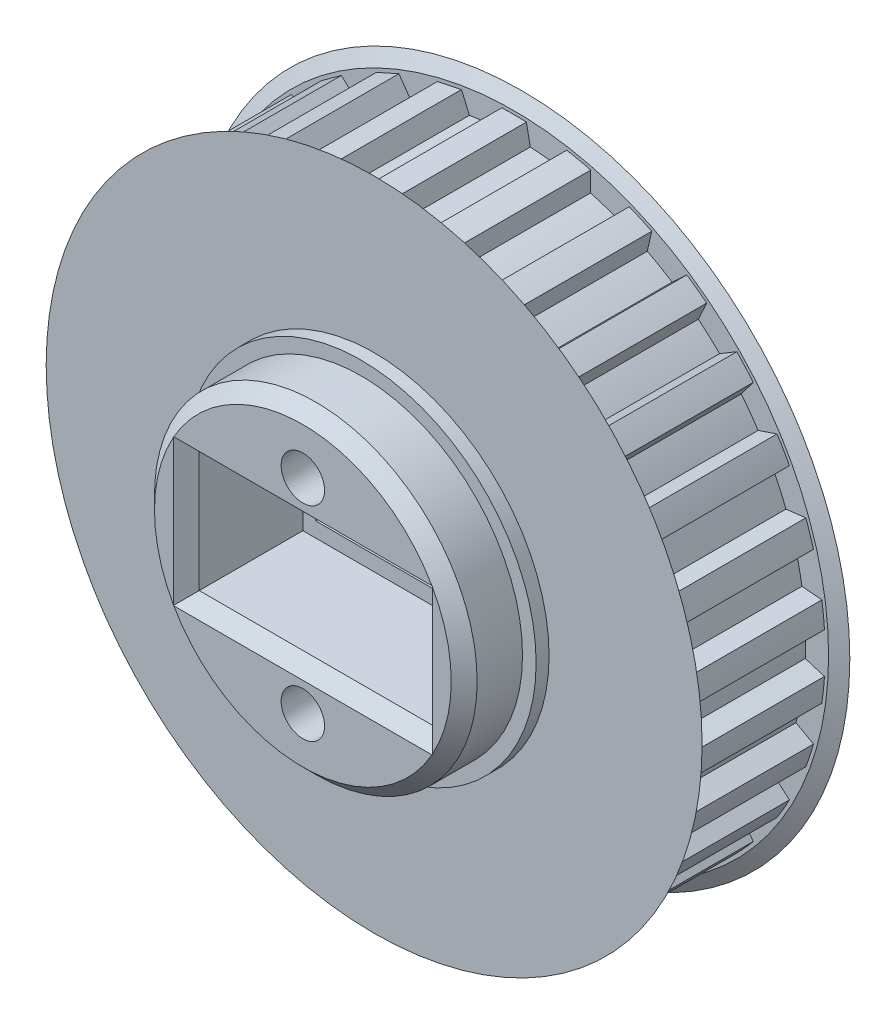
from build123d import *
from build123d.topology import SkipClean

# Parameters (mm, degrees)
CROQUIS1_R                 = 1.5
SALIENTE_EXTRUIR1_DEPTH    = 10.2
CROQUIS2_R                 = 26
CROQUIS2_R_2               = 1.5
SALIENTE_EXTRUIR2_DEPTH    = 0.6
SALIENTE_EXTRUIR4_START    = 4.25
CROQUIS4_R                 = 12.45
CROQUIS4_R_2               = 1.5
SALIENTE_EXTRUIR4_DEPTH    = 4.25
SALIENTE_EXTRUIR6_START    = 0.6
CROQUIS6_R                 = 26
CROQUIS6_R_2               = 1.5
SALIENTE_EXTRUIR6_DEPTH    = 0.6
SALIENTE_EXTRUIR5_START    = 1.6
CROQUIS5_R                 = 13.5
CROQUIS5_R_2               = 1.5
SALIENTE_EXTRUIR5_DEPTH    = 1.6
CHAFL_N2_SIZE              = 1.732050808
CHAFL_N2_SIZE_2            = 1
CROQUIS3_R                 = 12.45
CROQUIS3_R_2               = 1.5
SALIENTE_EXTRUIR7_DEPTH    = 5.5
CHAFL_N4_SIZE              = 1
CROQUIS7_R                 = 13.5
CROQUIS7_R_2               = 1.5
SALIENTE_EXTRUIR8_DEPTH    = 1
CORTAR_EXTRUIR1_DEPTH      = 40.326793492
CORTAR_EXTRUIR1_DEPTH_BACK = 40.326793492
CROQUIS8_R                 = 1.675
CROQUIS8_W                 = 16
CROQUIS8_H                 = 7
CROQUIS10_W                = 18
CROQUIS10_H                = 9.3
CORTAR_EXTRUIR3_DEPTH      = 9
CHAFL_N5_SIZE              = 1
SKETCH1_R                  = 12.45
SKETCH1_R_2                = 1.675
BOSS_EXTRUDE1_DEPTH        = 5
SKETCH2_R                  = 1.45
CUT_EXTRUDE1_DEPTH         = 5
SKETCH4_W                  = 8
SKETCH4_H                  = 7
CUT_EXTRUDE2_DEPTH         = 21
CHAMFER3_SIZE              = 1
CHAMFER2_SIZE              = 0.75


# Some blends are built 0.0001 mm under size
with BuildPart() as part:
    # Croquis1 → Saliente-Extruir1 (new body)
    with BuildSketch(Plane.XY):
        with BuildLine():
            Line((-0.95, 23.981190546), (-1.25, 22.465250945))
            ThreePointArc((-1.25, 22.465250945), (-2.351890424, 22.376742646), (-3.448103808, 22.234220925))
            Line((-3.448103808, 22.234220925), (-4.056729654, 23.654660102))
            Line((-4.056729654, 23.654660102), (-5.915210095, 23.259627889))
            Line((-5.915210095, 23.259627889), (-5.893472809, 21.714441698))
            ThreePointArc((-5.893472809, 21.714441698), (-6.952882373, 21.398771617), (-7.995508933, 21.031448759))
            Line((-7.995508933, 21.031448759), (-8.886160755, 22.294307503))
            Line((-8.886160755, 22.294307503), (-10.621897124, 21.521507881))
            Line((-10.621897124, 21.521507881), (-10.279372577, 20.014607151))
            ThreePointArc((-10.279372577, 20.014607151), (-11.25, 19.485571585), (-12.193471951, 18.909501362))
            Line((-12.193471951, 18.909501362), (-13.327223991, 19.959586687))
            Line((-13.327223991, 19.959586687), (-14.86435628, 18.842794707))
            Line((-14.86435628, 18.842794707), (-14.216014437, 17.440038232))
            ThreePointArc((-14.216014437, 17.440038232), (-15.055438643, 16.720758573), (-15.858521735, 15.961118018))
            Line((-15.858521735, 15.961118018), (-17.185823587, 16.752536155))
            Line((-17.185823587, 16.752536155), (-18.457171739, 15.340560987))
            Line((-18.457171739, 15.340560987), (-17.53134825, 14.103255955))
            ThreePointArc((-17.53134825, 14.103255955), (-18.202882373, 13.225168177), (-18.83047802, 12.315157227))
            Line((-18.83047802, 12.315157227), (-20.293320226, 12.813319407))
            ThreePointArc((-20.293320226, 12.813319407), (-20.784609691, 12), (-21.243320226, 11.167871139))
            Line((-21.243320226, 11.167871139), (-20.08047802, 10.150093718))
            ThreePointArc((-20.08047802, 10.150093718), (-20.554772797, 9.151574469), (-20.979452058, 8.13096497))
            Line((-20.979452058, 8.13096497), (-22.513901393, 8.314099115))
            ThreePointArc((-22.513901393, 8.314099115), (-22.825356391, 7.416407865), (-23.101033682, 6.507091734))
            Line((-23.101033682, 6.507091734), (-21.751994544, 5.753323679))
            ThreePointArc((-21.751994544, 5.753323679), (-22.008321017, 4.678013043), (-22.21152337, 3.591410527))
            Line((-22.21152337, 3.591410527), (-23.750517035, 3.451512796))
            ThreePointArc((-23.750517035, 3.451512796), (-23.868525489, 2.508683118), (-23.949121115, 1.561921194))
            Line((-23.949121115, 1.561921194), (-22.472844528, 1.105105789))
            ThreePointArc((-22.472844528, 1.105105789), (-22.5, 0), (-22.472844528, -1.105105789))
            Line((-22.472844528, -1.105105789), (-23.949121115, -1.561921194))
            ThreePointArc((-23.949121115, -1.561921194), (-23.868525489, -2.508683118), (-23.750517035, -3.451512796))
            Line((-23.750517035, -3.451512796), (-22.21152337, -3.591410527))
            ThreePointArc((-22.21152337, -3.591410527), (-22.008321017, -4.678013043), (-21.751994544, -5.753323679))
            Line((-21.751994544, -5.753323679), (-23.101033682, -6.507091734))
            ThreePointArc((-23.101033682, -6.507091734), (-22.825356391, -7.416407865), (-22.513901393, -8.314099115))
            Line((-22.513901393, -8.314099115), (-20.979452058, -8.13096497))
            ThreePointArc((-20.979452058, -8.13096497), (-20.554772797, -9.151574469), (-20.08047802, -10.150093718))
            Line((-20.08047802, -10.150093718), (-21.243320226, -11.167871139))
            ThreePointArc((-21.243320226, -11.167871139), (-20.784609691, -12), (-20.293320226, -12.813319407))
            Line((-20.293320226, -12.813319407), (-18.83047802, -12.315157227))
            ThreePointArc((-18.83047802, -12.315157227), (-18.202882373, -13.225168177), (-17.53134825, -14.103255955))
            Line((-17.53134825, -14.103255955), (-18.457171739, -15.340560987))
            ThreePointArc((-18.457171739, -15.340560987), (-17.835475811, -16.059134553), (-17.185823587, -16.752536155))
            Line((-17.185823587, -16.752536155), (-15.858521735, -15.961118018))
            ThreePointArc((-15.858521735, -15.961118018), (-15.055438643, -16.720758573), (-14.216014437, -17.440038232))
            Line((-14.216014437, -17.440038232), (-14.86435628, -18.842794707))
            ThreePointArc((-14.86435628, -18.842794707), (-14.106846055, -19.416407865), (-13.327223991, -19.959586687))
            Line((-13.327223991, -19.959586687), (-12.193471951, -18.909501362))
            ThreePointArc((-12.193471951, -18.909501362), (-11.25, -19.485571585), (-10.279372577, -20.014607151))
            Line((-10.279372577, -20.014607151), (-10.621897124, -21.521507881))
            ThreePointArc((-10.621897124, -21.521507881), (-9.761679434, -21.925090983), (-8.886160755, -22.294307503))
            Line((-8.886160755, -22.294307503), (-7.995508933, -21.031448759))
            ThreePointArc((-7.995508933, -21.031448759), (-6.952882373, -21.398771617), (-5.893472809, -21.714441698))
            Line((-5.893472809, -21.714441698), (-5.915210095, -23.259627889))
            ThreePointArc((-5.915210095, -23.259627889), (-4.98988058, -23.475542418), (-4.056729654, -23.654660102))
            Line((-4.056729654, -23.654660102), (-3.448103808, -22.234220925))
            ThreePointArc((-3.448103808, -22.234220925), (-2.351890424, -22.376742646), (-1.25, -22.465250945))
            Line((-1.25, -22.465250945), (-0.95, -23.981190546))
            ThreePointArc((-0.95, -23.981190546), (0, -24), (0.95, -23.981190546))
            Line((0.95, -23.981190546), (1.25, -22.465250945))
            ThreePointArc((1.25, -22.465250945), (2.351890424, -22.376742646), (3.448103808, -22.234220925))
            Line((3.448103808, -22.234220925), (4.056729654, -23.654660102))
            ThreePointArc((4.056729654, -23.654660102), (4.98988058, -23.475542418), (5.915210095, -23.259627889))
            Line((5.915210095, -23.259627889), (5.893472809, -21.714441698))
            ThreePointArc((5.893472809, -21.714441698), (6.952882373, -21.398771617), (7.995508933, -21.031448759))
            Line((7.995508933, -21.031448759), (8.886160755, -22.294307503))
            ThreePointArc((8.886160755, -22.294307503), (9.761679434, -21.925090983), (10.621897124, -21.521507881))
            Line((10.621897124, -21.521507881), (10.279372577, -20.014607151))
            ThreePointArc((10.279372577, -20.014607151), (11.25, -19.485571585), (12.193471951, -18.909501362))
            Line((12.193471951, -18.909501362), (13.327223991, -19.959586687))
            ThreePointArc((13.327223991, -19.959586687), (14.106846055, -19.416407865), (14.86435628, -18.842794707))
            Line((14.86435628, -18.842794707), (14.216014437, -17.440038232))
            ThreePointArc((14.216014437, -17.440038232), (15.055438643, -16.720758573), (15.858521735, -15.961118018))
            Line((15.858521735, -15.961118018), (17.185823587, -16.752536155))
            ThreePointArc((17.185823587, -16.752536155), (17.835475811, -16.059134553), (18.457171739, -15.340560987))
            Line((18.457171739, -15.340560987), (17.53134825, -14.103255955))
            ThreePointArc((17.53134825, -14.103255955), (18.202882373, -13.225168177), (18.83047802, -12.315157227))
            Line((18.83047802, -12.315157227), (20.293320226, -12.813319407))
            ThreePointArc((20.293320226, -12.813319407), (20.784609691, -12), (21.243320226, -11.167871139))
            Line((21.243320226, -11.167871139), (20.08047802, -10.150093718))
            ThreePointArc((20.08047802, -10.150093718), (20.554772797, -9.151574469), (20.979452058, -8.13096497))
            Line((20.979452058, -8.13096497), (22.513901393, -8.314099115))
            ThreePointArc((22.513901393, -8.314099115), (22.825356391, -7.416407865), (23.101033682, -6.507091734))
            Line((23.101033682, -6.507091734), (21.751994544, -5.753323679))
            ThreePointArc((21.751994544, -5.753323679), (22.008321017, -4.678013043), (22.21152337, -3.591410527))
            Line((22.21152337, -3.591410527), (23.750517035, -3.451512796))
            ThreePointArc((23.750517035, -3.451512796), (23.868525489, -2.508683118), (23.949121115, -1.561921194))
            Line((23.949121115, -1.561921194), (22.472844528, -1.105105789))
            ThreePointArc((22.472844528, -1.105105789), (22.5, 0), (22.472844528, 1.105105789))
            Line((22.472844528, 1.105105789), (23.949121115, 1.561921194))
            ThreePointArc((23.949121115, 1.561921194), (23.868525489, 2.508683118), (23.750517035, 3.451512796))
            Line((23.750517035, 3.451512796), (22.21152337, 3.591410527))
            ThreePointArc((22.21152337, 3.591410527), (22.008321017, 4.678013043), (21.751994544, 5.753323679))
            Line((21.751994544, 5.753323679), (23.101033682, 6.507091734))
            ThreePointArc((23.101033682, 6.507091734), (22.825356391, 7.416407865), (22.513901393, 8.314099115))
            Line((22.513901393, 8.314099115), (20.979452058, 8.13096497))
            ThreePointArc((20.979452058, 8.13096497), (20.554772797, 9.151574469), (20.08047802, 10.150093718))
            Line((20.08047802, 10.150093718), (21.243320226, 11.167871139))
            ThreePointArc((21.243320226, 11.167871139), (20.784609691, 12), (20.293320226, 12.813319407))
            Line((20.293320226, 12.813319407), (18.83047802, 12.315157227))
            ThreePointArc((18.83047802, 12.315157227), (18.202882373, 13.225168177), (17.53134825, 14.103255955))
            Line((17.53134825, 14.103255955), (18.457171739, 15.340560987))
            ThreePointArc((18.457171739, 15.340560987), (17.835475811, 16.059134553), (17.185823587, 16.752536155))
            Line((17.185823587, 16.752536155), (15.858521735, 15.961118018))
            ThreePointArc((15.858521735, 15.961118018), (15.055438643, 16.720758573), (14.216014437, 17.440038232))
            Line((14.216014437, 17.440038232), (14.86435628, 18.842794707))
            ThreePointArc((14.86435628, 18.842794707), (14.106846055, 19.416407865), (13.327223991, 19.959586687))
            Line((13.327223991, 19.959586687), (12.193471951, 18.909501362))
            ThreePointArc((12.193471951, 18.909501362), (11.25, 19.485571585), (10.279372577, 20.014607151))
            Line((10.279372577, 20.014607151), (10.621897124, 21.521507881))
            ThreePointArc((10.621897124, 21.521507881), (9.761679434, 21.925090983), (8.886160755, 22.294307503))
            Line((8.886160755, 22.294307503), (7.995508933, 21.031448759))
            ThreePointArc((7.995508933, 21.031448759), (6.952882373, 21.398771617), (5.893472809, 21.714441698))
            Line((5.893472809, 21.714441698), (5.915210095, 23.259627889))
            ThreePointArc((5.915210095, 23.259627889), (4.98988058, 23.475542418), (4.056729654, 23.654660102))
            Line((4.056729654, 23.654660102), (3.448103808, 22.234220925))
            ThreePointArc((3.448103808, 22.234220925), (2.351890424, 22.376742646), (1.25, 22.465250945))
            Line((1.25, 22.465250945), (0.95, 23.981190546))
            ThreePointArc((0.95, 23.981190546), (0, 24), (-0.95, 23.981190546))
        make_face()
        Circle(CROQUIS1_R, mode=Mode.SUBTRACT)
    extrude(amount=SALIENTE_EXTRUIR1_DEPTH)

    # Croquis2 → Saliente-Extruir2 (add)
    with BuildSketch(Plane.XY.offset(10.2)):
        Circle(CROQUIS2_R)
        Circle(CROQUIS2_R_2, mode=Mode.SUBTRACT)
    extrude(amount=SALIENTE_EXTRUIR2_DEPTH)

    # Croquis4 → Saliente-Extruir4 (add)
    with BuildSketch(Plane(origin=(0, 0, 0), x_dir=(-1, 0, 0), z_dir=(0, 0, -1)).offset(SALIENTE_EXTRUIR4_START)):
        with Locations(Location((0, 0, 0), (0, 0, 180))):
            Circle(CROQUIS4_R)
        Circle(CROQUIS4_R_2, mode=Mode.SUBTRACT)
    extrude(amount=-SALIENTE_EXTRUIR4_DEPTH)

    # Croquis6 → Saliente-Extruir6 (add)
    with SkipClean():  # the faces are left unmerged after this step: merging them gives an invalid solid
        with BuildSketch(Plane(origin=(0, 0, 0), x_dir=(-1, 0, 0), z_dir=(0, 0, -1)).offset(SALIENTE_EXTRUIR6_START)):
            with Locations(Location((0, 0, 0), (0, 0, 180))):
                Circle(CROQUIS6_R)
            Circle(CROQUIS6_R_2, mode=Mode.SUBTRACT)
        extrude(amount=-SALIENTE_EXTRUIR6_DEPTH)

    # Croquis5 → Saliente-Extruir5 (add)
    with SkipClean():  # the faces are left unmerged after this step: merging them gives an invalid solid
        with BuildSketch(Plane(origin=(0, 0, -0.6), x_dir=(-1, 0, 0), z_dir=(0, 0, -1)).offset(SALIENTE_EXTRUIR5_START)):
            Circle(CROQUIS5_R)
            Circle(CROQUIS5_R_2, mode=Mode.SUBTRACT)
        extrude(amount=-SALIENTE_EXTRUIR5_DEPTH)

    # Chaflán2
    # the kernel refuses this chamfer: 1.732050808, 1 mm, written as the material it takes off along each edge
    with BuildSketch(Plane(origin=(0, 0, 0), x_dir=(1, 0, 0), z_dir=(0, 1, 0))) as chafl_n2_piece_1:
        Polygon((26 - CHAFL_N2_SIZE, 0), (26, CHAFL_N2_SIZE_2), (26, 0), align=None)
    revolve(axis=Axis((0, 0, 0), (0, 0, -1)), mode=Mode.SUBTRACT)
    with BuildSketch(Plane(origin=(0, 0, 10.2), x_dir=(1, 0, 0), z_dir=(0, -1, 0))) as chafl_n2_piece_2:
        Polygon((26 - CHAFL_N2_SIZE, 0), (26, CHAFL_N2_SIZE_2), (26, 0), align=None)
    revolve(axis=Axis((0, 0, 10.2), (0, 0, 1)), mode=Mode.SUBTRACT)

    # Croquis3 → Saliente-Extruir7 (add)
    with BuildSketch(Plane.XY.offset(10.8)):
        with Locations(Location((0, 0, 0), (0, 0, 180))):
            Circle(CROQUIS3_R)
        with Locations(Location((0, 0, 0), (0, 0, 180))):
            Circle(CROQUIS3_R_2, mode=Mode.SUBTRACT)
    extrude(amount=SALIENTE_EXTRUIR7_DEPTH)

    # Chaflán4
    chafl_n4_edges = [part.edges().sort_by_distance(p)[0] for p in [
        (12.45, 0, 16.3),
    ]]
    chamfer(chafl_n4_edges, length=CHAFL_N4_SIZE)

    # Croquis7 → Saliente-Extruir8 (add)
    with BuildSketch(Plane.XY.offset(10.8)):
        with Locations(Location((0, 0, 0), (0, 0, 180))):
            Circle(CROQUIS7_R)
        with Locations(Location((0, 0, 0), (0, 0, 180))):
            Circle(CROQUIS7_R_2, mode=Mode.SUBTRACT)
    extrude(amount=SALIENTE_EXTRUIR8_DEPTH)

    # Croquis8 → Cortar-Extruir1 (cut, two sides: drawn at the far end of the back side and taken through both)
    with BuildSketch(Plane.XY.offset(-CORTAR_EXTRUIR1_DEPTH_BACK)):
        with Locations((0, 7.875631857)):
            Circle(CROQUIS8_R)
        with Locations((0, -7.875631857)):
            Circle(CROQUIS8_R)
        Rectangle(CROQUIS8_W, CROQUIS8_H)
    extrude(amount=CORTAR_EXTRUIR1_DEPTH + CORTAR_EXTRUIR1_DEPTH_BACK, mode=Mode.SUBTRACT)

    # Croquis10 → Cortar-Extruir3 (cut)
    with BuildSketch(Plane.XY.offset(16.3)):
        Rectangle(CROQUIS10_W, CROQUIS10_H)
    extrude(amount=-CORTAR_EXTRUIR3_DEPTH, mode=Mode.SUBTRACT)

    # Chaflán5
    # the kernel refuses this chamfer: 1 mm, written as the material it takes off along each edge
    with BuildSketch(Plane(origin=(8, 3.5, -4.25), x_dir=(0.9996219169112968, 0, -0.02749587661058651), z_dir=(0, -1, 0)), Plane(origin=(-8, -3.5, -4.25), x_dir=(-0.9996219169112968, 0, -0.02749587661058651), z_dir=(0, 1, 0))) as chafl_n5_piece_1:
        Polygon((CHAFL_N5_SIZE * 0.999621916911, CHAFL_N5_SIZE * 0.0274958766106), (-CHAFL_N5_SIZE * 0.0274958766106, CHAFL_N5_SIZE * 0.999621916911), (0, 0), align=None)
    extrude(amount=7, mode=Mode.SUBTRACT)
    with BuildSketch(Plane(origin=(8, -3.5, -4.25), x_dir=(0, -0.9996219169112968, -0.027495876610586497), z_dir=(-1, 0, 0)), Plane(origin=(-8, 3.5, -4.25), x_dir=(0, 0.9996219169112968, -0.027495876610586487), z_dir=(1, 0, 0))) as chafl_n5_piece_2:
        Polygon((CHAFL_N5_SIZE * 0.999621916911, CHAFL_N5_SIZE * 0.0274958766106), (-CHAFL_N5_SIZE * 0.0274958766106, CHAFL_N5_SIZE * 0.999621916911), (0, 0), align=None)
    extrude(amount=16, mode=Mode.SUBTRACT)
    with BuildSketch(Plane(origin=(-9, 4.65, 16.3), x_dir=(-0.9996219169112968, 0, 0.027495876610585647), z_dir=(0, -1, 0)), Plane(origin=(9, -4.65, 16.3), x_dir=(0.9996219169112968, 0, 0.027495876610585647), z_dir=(0, 1, 0))) as chafl_n5_piece_3:
        Polygon((CHAFL_N5_SIZE * 0.999621916911, CHAFL_N5_SIZE * 0.0274958766106), (-CHAFL_N5_SIZE * 0.0274958766106, CHAFL_N5_SIZE * 0.999621916911), (0, 0), align=None)
    extrude(amount=9.3, mode=Mode.SUBTRACT)
    with BuildSketch(Plane(origin=(-9, -4.65, 16.3), x_dir=(0, -0.9996219169112968, 0.027495876610585623), z_dir=(1, 0, 0)), Plane(origin=(9, 4.65, 16.3), x_dir=(0, 0.9996219169112968, 0.027495876610585623), z_dir=(-1, 0, 0))) as chafl_n5_piece_4:
        Polygon((CHAFL_N5_SIZE * 0.999621916911, CHAFL_N5_SIZE * 0.0274958766106), (-CHAFL_N5_SIZE * 0.0274958766106, CHAFL_N5_SIZE * 0.999621916911), (0, 0), align=None)
    extrude(amount=18, mode=Mode.SUBTRACT)
    with BuildSketch(Plane(origin=(-8, 3.5, -4.25), x_dir=(0, 0.9996219169112968, -0.027495876610586487), z_dir=(1, 0, 0))) as chafl_n5_piece_5a_section:
        Polygon((CHAFL_N5_SIZE * 0.999621916911, CHAFL_N5_SIZE * 0.0274958766106), (-CHAFL_N5_SIZE * 0.0274958766106, CHAFL_N5_SIZE * 0.999621916911), (0, 0), align=None)
    chafl_n5_piece_5a = extrude(amount=18.571682988, mode=Mode.PRIVATE)
    chafl_n5_piece_5a = split(chafl_n5_piece_5a, bisect_by=Plane(origin=(8, 3.829793627, -3.920206373), z_dir=(1, 0, 0)), keep=Keep.TOP, mode=Mode.PRIVATE)
    with BuildSketch(Plane(origin=(8, 6.071682988, -4.25), x_dir=(0.9996219169112968, 0, -0.02749587661058651), z_dir=(0, -1, 0))) as chafl_n5_piece_5b_section:
        Polygon((CHAFL_N5_SIZE * 0.999621916911, CHAFL_N5_SIZE * 0.0274958766106), (-CHAFL_N5_SIZE * 0.0274958766106, CHAFL_N5_SIZE * 0.999621916911), (0, 0), align=None)
    chafl_n5_piece_5b = extrude(amount=9.571682988, mode=Mode.PRIVATE)
    chafl_n5_piece_5b = split(chafl_n5_piece_5b, bisect_by=Plane(origin=(8.329793627, 3.5, -3.920206373), z_dir=(0, 1, 0)), keep=Keep.TOP, mode=Mode.PRIVATE)
    chafl_n5_piece_5 = chafl_n5_piece_5a & chafl_n5_piece_5b
    add(chafl_n5_piece_5, mode=Mode.SUBTRACT)
    with BuildSketch(Plane(origin=(8, 3.5, -4.25), x_dir=(0.9996219169112968, 0, -0.02749587661058651), z_dir=(0, -1, 0))) as chafl_n5_piece_6a_section:
        Polygon((CHAFL_N5_SIZE * 0.999621916911, CHAFL_N5_SIZE * 0.0274958766106), (-CHAFL_N5_SIZE * 0.0274958766106, CHAFL_N5_SIZE * 0.999621916911), (0, 0), align=None)
    chafl_n5_piece_6a = extrude(amount=9.571682988, mode=Mode.PRIVATE)
    chafl_n5_piece_6a = split(chafl_n5_piece_6a, bisect_by=Plane(origin=(8.329793627, -3.5, -3.920206373), z_dir=(0, -1, 0)), keep=Keep.TOP, mode=Mode.PRIVATE)
    with BuildSketch(Plane(origin=(10.571682988, -3.5, -4.25), x_dir=(0, -0.9996219169112968, -0.027495876610586497), z_dir=(-1, 0, 0))) as chafl_n5_piece_6b_section:
        Polygon((CHAFL_N5_SIZE * 0.999621916911, CHAFL_N5_SIZE * 0.0274958766106), (-CHAFL_N5_SIZE * 0.0274958766106, CHAFL_N5_SIZE * 0.999621916911), (0, 0), align=None)
    chafl_n5_piece_6b = extrude(amount=18.571682988, mode=Mode.PRIVATE)
    chafl_n5_piece_6b = split(chafl_n5_piece_6b, bisect_by=Plane(origin=(8, -3.829793627, -3.920206373), z_dir=(1, 0, 0)), keep=Keep.TOP, mode=Mode.PRIVATE)
    chafl_n5_piece_6 = chafl_n5_piece_6a & chafl_n5_piece_6b
    add(chafl_n5_piece_6, mode=Mode.SUBTRACT)
    with BuildSketch(Plane(origin=(8, -3.5, -4.25), x_dir=(0, -0.9996219169112968, -0.027495876610586497), z_dir=(-1, 0, 0))) as chafl_n5_piece_7a_section:
        Polygon((CHAFL_N5_SIZE * 0.999621916911, CHAFL_N5_SIZE * 0.0274958766106), (-CHAFL_N5_SIZE * 0.0274958766106, CHAFL_N5_SIZE * 0.999621916911), (0, 0), align=None)
    chafl_n5_piece_7a = extrude(amount=18.571682988, mode=Mode.PRIVATE)
    chafl_n5_piece_7a = split(chafl_n5_piece_7a, bisect_by=Plane(origin=(-8, -3.829793627, -3.920206373), z_dir=(-1, 0, 0)), keep=Keep.TOP, mode=Mode.PRIVATE)
    with BuildSketch(Plane(origin=(-8, -6.071682988, -4.25), x_dir=(-0.9996219169112968, 0, -0.02749587661058651), z_dir=(0, 1, 0))) as chafl_n5_piece_7b_section:
        Polygon((CHAFL_N5_SIZE * 0.999621916911, CHAFL_N5_SIZE * 0.0274958766106), (-CHAFL_N5_SIZE * 0.0274958766106, CHAFL_N5_SIZE * 0.999621916911), (0, 0), align=None)
    chafl_n5_piece_7b = extrude(amount=9.571682988, mode=Mode.PRIVATE)
    chafl_n5_piece_7b = split(chafl_n5_piece_7b, bisect_by=Plane(origin=(-8.329793627, -3.5, -3.920206373), z_dir=(0, -1, 0)), keep=Keep.TOP, mode=Mode.PRIVATE)
    chafl_n5_piece_7 = chafl_n5_piece_7a & chafl_n5_piece_7b
    add(chafl_n5_piece_7, mode=Mode.SUBTRACT)
    with BuildSketch(Plane(origin=(-10.571682988, 3.5, -4.25), x_dir=(0, 0.9996219169112968, -0.027495876610586487), z_dir=(1, 0, 0))) as chafl_n5_piece_8a_section:
        Polygon((CHAFL_N5_SIZE * 0.999621916911, CHAFL_N5_SIZE * 0.0274958766106), (-CHAFL_N5_SIZE * 0.0274958766106, CHAFL_N5_SIZE * 0.999621916911), (0, 0), align=None)
    chafl_n5_piece_8a = extrude(amount=18.571682988, mode=Mode.PRIVATE)
    chafl_n5_piece_8a = split(chafl_n5_piece_8a, bisect_by=Plane(origin=(-8, 3.829793627, -3.920206373), z_dir=(-1, 0, 0)), keep=Keep.TOP, mode=Mode.PRIVATE)
    with BuildSketch(Plane(origin=(-8, -3.5, -4.25), x_dir=(-0.9996219169112968, 0, -0.02749587661058651), z_dir=(0, 1, 0))) as chafl_n5_piece_8b_section:
        Polygon((CHAFL_N5_SIZE * 0.999621916911, CHAFL_N5_SIZE * 0.0274958766106), (-CHAFL_N5_SIZE * 0.0274958766106, CHAFL_N5_SIZE * 0.999621916911), (0, 0), align=None)
    chafl_n5_piece_8b = extrude(amount=9.571682988, mode=Mode.PRIVATE)
    chafl_n5_piece_8b = split(chafl_n5_piece_8b, bisect_by=Plane(origin=(-8.329793627, 3.5, -3.920206373), z_dir=(0, 1, 0)), keep=Keep.TOP, mode=Mode.PRIVATE)
    chafl_n5_piece_8 = chafl_n5_piece_8a & chafl_n5_piece_8b
    add(chafl_n5_piece_8, mode=Mode.SUBTRACT)
    with BuildSketch(Plane(origin=(9, 4.65, 16.3), x_dir=(0, 0.9996219169112968, 0.027495876610585623), z_dir=(-1, 0, 0))) as chafl_n5_piece_9a_section:
        Polygon((CHAFL_N5_SIZE * 0.999621916911, CHAFL_N5_SIZE * 0.0274958766106), (-CHAFL_N5_SIZE * 0.0274958766106, CHAFL_N5_SIZE * 0.999621916911), (0, 0), align=None)
    chafl_n5_piece_9a = extrude(amount=20.571682988, mode=Mode.PRIVATE)
    chafl_n5_piece_9a = split(chafl_n5_piece_9a, bisect_by=Plane(origin=(-9, 4.979793627, 15.970206373), z_dir=(-1, 0, 0)), keep=Keep.TOP, mode=Mode.PRIVATE)
    with BuildSketch(Plane(origin=(-9, 7.221682988, 16.3), x_dir=(-0.9996219169112968, 0, 0.027495876610585647), z_dir=(0, -1, 0))) as chafl_n5_piece_9b_section:
        Polygon((CHAFL_N5_SIZE * 0.999621916911, CHAFL_N5_SIZE * 0.0274958766106), (-CHAFL_N5_SIZE * 0.0274958766106, CHAFL_N5_SIZE * 0.999621916911), (0, 0), align=None)
    chafl_n5_piece_9b = extrude(amount=11.871682988, mode=Mode.PRIVATE)
    chafl_n5_piece_9b = split(chafl_n5_piece_9b, bisect_by=Plane(origin=(-9.329793627, 4.65, 15.970206373), z_dir=(0, 1, 0)), keep=Keep.TOP, mode=Mode.PRIVATE)
    chafl_n5_piece_9 = chafl_n5_piece_9a & chafl_n5_piece_9b
    add(chafl_n5_piece_9, mode=Mode.SUBTRACT)
    with BuildSketch(Plane(origin=(-9, 4.65, 16.3), x_dir=(-0.9996219169112968, 0, 0.027495876610585647), z_dir=(0, -1, 0))) as chafl_n5_piece_10a_section:
        Polygon((CHAFL_N5_SIZE * 0.999621916911, CHAFL_N5_SIZE * 0.0274958766106), (-CHAFL_N5_SIZE * 0.0274958766106, CHAFL_N5_SIZE * 0.999621916911), (0, 0), align=None)
    chafl_n5_piece_10a = extrude(amount=11.871682988, mode=Mode.PRIVATE)
    chafl_n5_piece_10a = split(chafl_n5_piece_10a, bisect_by=Plane(origin=(-9.329793627, -4.65, 15.970206373), z_dir=(0, -1, 0)), keep=Keep.TOP, mode=Mode.PRIVATE)
    with BuildSketch(Plane(origin=(-11.571682988, -4.65, 16.3), x_dir=(0, -0.9996219169112968, 0.027495876610585623), z_dir=(1, 0, 0))) as chafl_n5_piece_10b_section:
        Polygon((CHAFL_N5_SIZE * 0.999621916911, CHAFL_N5_SIZE * 0.0274958766106), (-CHAFL_N5_SIZE * 0.0274958766106, CHAFL_N5_SIZE * 0.999621916911), (0, 0), align=None)
    chafl_n5_piece_10b = extrude(amount=20.571682988, mode=Mode.PRIVATE)
    chafl_n5_piece_10b = split(chafl_n5_piece_10b, bisect_by=Plane(origin=(-9, -4.979793627, 15.970206373), z_dir=(-1, 0, 0)), keep=Keep.TOP, mode=Mode.PRIVATE)
    chafl_n5_piece_10 = chafl_n5_piece_10a & chafl_n5_piece_10b
    add(chafl_n5_piece_10, mode=Mode.SUBTRACT)
    with BuildSketch(Plane(origin=(-9, -4.65, 16.3), x_dir=(0, -0.9996219169112968, 0.027495876610585623), z_dir=(1, 0, 0))) as chafl_n5_piece_11a_section:
        Polygon((CHAFL_N5_SIZE * 0.999621916911, CHAFL_N5_SIZE * 0.0274958766106), (-CHAFL_N5_SIZE * 0.0274958766106, CHAFL_N5_SIZE * 0.999621916911), (0, 0), align=None)
    chafl_n5_piece_11a = extrude(amount=20.571682988, mode=Mode.PRIVATE)
    chafl_n5_piece_11a = split(chafl_n5_piece_11a, bisect_by=Plane(origin=(9, -4.979793627, 15.970206373), z_dir=(1, 0, 0)), keep=Keep.TOP, mode=Mode.PRIVATE)
    with BuildSketch(Plane(origin=(9, -7.221682988, 16.3), x_dir=(0.9996219169112968, 0, 0.027495876610585647), z_dir=(0, 1, 0))) as chafl_n5_piece_11b_section:
        Polygon((CHAFL_N5_SIZE * 0.999621916911, CHAFL_N5_SIZE * 0.0274958766106), (-CHAFL_N5_SIZE * 0.0274958766106, CHAFL_N5_SIZE * 0.999621916911), (0, 0), align=None)
    chafl_n5_piece_11b = extrude(amount=11.871682988, mode=Mode.PRIVATE)
    chafl_n5_piece_11b = split(chafl_n5_piece_11b, bisect_by=Plane(origin=(9.329793627, -4.65, 15.970206373), z_dir=(0, -1, 0)), keep=Keep.TOP, mode=Mode.PRIVATE)
    chafl_n5_piece_11 = chafl_n5_piece_11a & chafl_n5_piece_11b
    add(chafl_n5_piece_11, mode=Mode.SUBTRACT)
    with BuildSketch(Plane(origin=(11.571682988, 4.65, 16.3), x_dir=(0, 0.9996219169112968, 0.027495876610585623), z_dir=(-1, 0, 0))) as chafl_n5_piece_12a_section:
        Polygon((CHAFL_N5_SIZE * 0.999621916911, CHAFL_N5_SIZE * 0.0274958766106), (-CHAFL_N5_SIZE * 0.0274958766106, CHAFL_N5_SIZE * 0.999621916911), (0, 0), align=None)
    chafl_n5_piece_12a = extrude(amount=20.571682988, mode=Mode.PRIVATE)
    chafl_n5_piece_12a = split(chafl_n5_piece_12a, bisect_by=Plane(origin=(9, 4.979793627, 15.970206373), z_dir=(1, 0, 0)), keep=Keep.TOP, mode=Mode.PRIVATE)
    with BuildSketch(Plane(origin=(9, -4.65, 16.3), x_dir=(0.9996219169112968, 0, 0.027495876610585647), z_dir=(0, 1, 0))) as chafl_n5_piece_12b_section:
        Polygon((CHAFL_N5_SIZE * 0.999621916911, CHAFL_N5_SIZE * 0.0274958766106), (-CHAFL_N5_SIZE * 0.0274958766106, CHAFL_N5_SIZE * 0.999621916911), (0, 0), align=None)
    chafl_n5_piece_12b = extrude(amount=11.871682988, mode=Mode.PRIVATE)
    chafl_n5_piece_12b = split(chafl_n5_piece_12b, bisect_by=Plane(origin=(9.329793627, 4.65, 15.970206373), z_dir=(0, 1, 0)), keep=Keep.TOP, mode=Mode.PRIVATE)
    chafl_n5_piece_12 = chafl_n5_piece_12a & chafl_n5_piece_12b
    add(chafl_n5_piece_12, mode=Mode.SUBTRACT)

    # Sketch1 → Boss-Extrude1 (add)
    with BuildSketch(Plane(origin=(0, 0, -4.25), x_dir=(-1, 0, 0), z_dir=(0, 0, -1))):
        Circle(SKETCH1_R)
        with Locations(Location((0, 7.875631857, 0), (0, 0, 180))):
            Circle(SKETCH1_R_2, mode=Mode.SUBTRACT)
        with Locations(Location((0, -7.875631857, 0), (0, 0, 180))):
            Circle(SKETCH1_R_2, mode=Mode.SUBTRACT)
    extrude(amount=-BOSS_EXTRUDE1_DEPTH)

    # Sketch2 → Cut-Extrude1 (cut)
    with BuildSketch(Plane(origin=(0, 0, -4.25), x_dir=(-1, 0, 0), z_dir=(0, 0, -1))):
        with Locations((-7.363007171, 0)):
            Circle(SKETCH2_R)
        with Locations(Location((7.363007171, 0, 0), (0, 0, 296.059571259))):
            Circle(SKETCH2_R)
    extrude(amount=-CUT_EXTRUDE1_DEPTH, mode=Mode.SUBTRACT)

    # Sketch4 → Cut-Extrude2 (cut)
    with BuildSketch(Plane.XY.offset(16.3)):
        Rectangle(SKETCH4_W, SKETCH4_H)
    extrude(amount=-CUT_EXTRUDE2_DEPTH, mode=Mode.SUBTRACT)

    # Chamfer3
    chamfer3_edges = [part.edges().sort_by_distance(p)[0] for p in [
        (-4, 0, -4.25),
        (0, 3.5, -4.25),
        (4, 0, -4.25),
        (0, -3.5, -4.25),
    ]]
    chamfer(chamfer3_edges, length=CHAMFER3_SIZE - 0.0001)  # a hair under: the kernel refuses the full size

    # Chamfer2
    chamfer2_edges = [part.edges().sort_by_distance(p)[0] for p in [
        (-12.45, 0, -4.25),
    ]]
    chamfer(chamfer2_edges, length=CHAMFER2_SIZE)


solid = part.part
